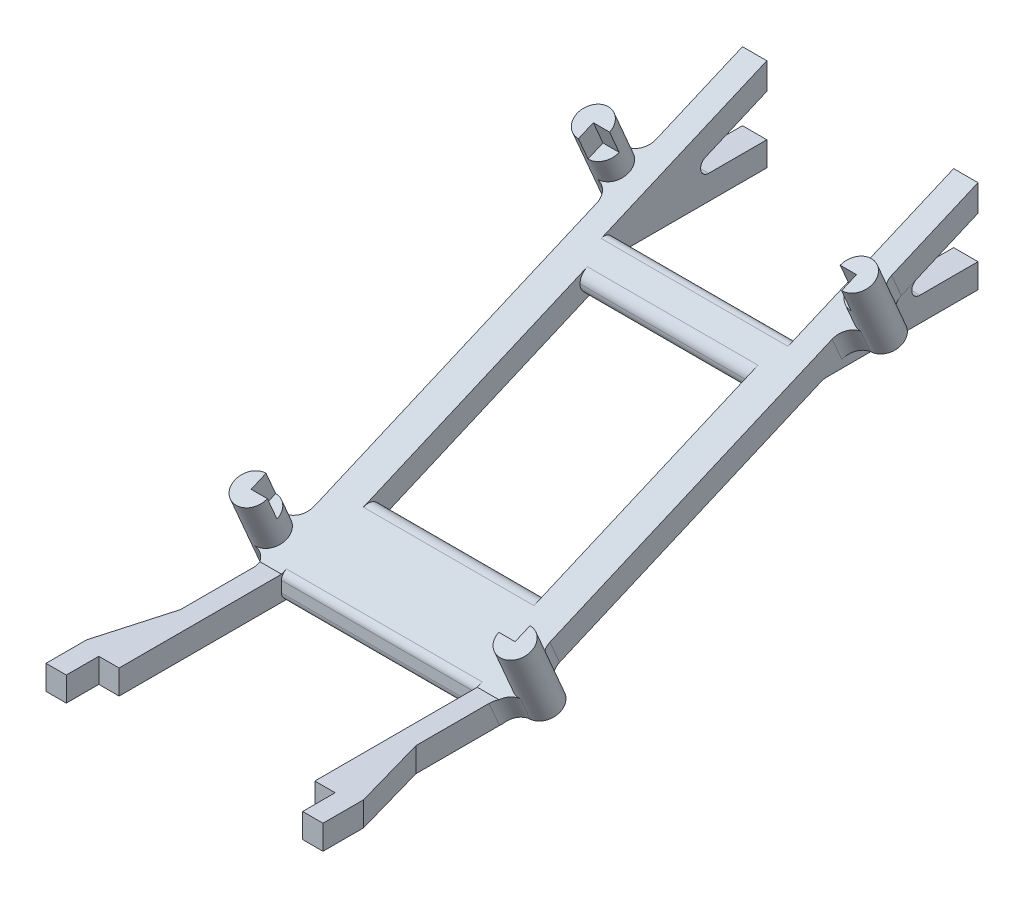
from build123d import *
from build123d.topology import SkipClean

# Parameters (mm, degrees)
BOSS_EXTRUDE1_DEPTH   = 29
SKETCH2_W             = 24.1
SKETCH2_H             = 40
CUT_EXTRUDE1_DEPTH    = 28
SKETCH3_W             = 21
SKETCH3_H             = 24.583031318
CUT_EXTRUDE2_DEPTH    = 28
SKETCH4_W             = 23
SKETCH4_H             = 38
CUT_EXTRUDE3_DEPTH    = 87.03859599
BOSS_EXTRUDE2_DEPTH   = 6
BOSS_EXTRUDE2_2_DEPTH = 6
SKETCH7_R             = 2
BOSS_EXTRUDE3_DEPTH   = 3
SKETCH8_R             = 2
BOSS_EXTRUDE4_DEPTH   = 3
FILLET5_R             = 1
FILLET1_R             = 2
BOSS_EXTRUDE5_DEPTH   = 6
BOSS_EXTRUDE5_2_DEPTH = 6
SKETCH10_R            = 2
BOSS_EXTRUDE6_DEPTH   = 3
SKETCH11_R            = 2
BOSS_EXTRUDE7_DEPTH   = 3
FILLET2_R             = 2
FILLET3_R             = 1
FILLET4_R             = 1.5
FILLET6_R             = 1
FILLET7_R             = 1
BOSS_EXTRUDE8_DEPTH   = 3


# Some blends are built 0.0001 mm under size
with BuildPart() as part:
    # Sketch1 → Boss-Extrude1 (new body)
    with BuildSketch(Plane(origin=(0, 0, 0), x_dir=(0, 0, -1), z_dir=(1, 0, 0))):
        Polygon((0, 0), (20.616968682, 0), (60.2, 17), (79.2, 17), (79.2, 20), (67.185240821, 20), (79.2, 25.16006226), (79.2, 28.425036095), (20, 3), (0, 3), align=None)
    extrude(amount=BOSS_EXTRUDE1_DEPTH)

    # Sketch2 → Cut-Extrude1 (cut)
    with BuildSketch(Plane(origin=(0, 3, 0), x_dir=(1, 0, 0), z_dir=(0, 1, 0))):
        with Locations((14.5, 0)):
            Rectangle(SKETCH2_W, SKETCH2_H)
    extrude(amount=-CUT_EXTRUDE1_DEPTH, mode=Mode.SUBTRACT)

    # Sketch3 → Cut-Extrude2 (cut)
    with BuildSketch(Plane.XZ):
        with Locations((14.5, -42.908484341)):
            Rectangle(SKETCH3_W, SKETCH3_H)
    extrude(amount=-CUT_EXTRUDE2_DEPTH, mode=Mode.SUBTRACT)

    # Sketch4 → Cut-Extrude3 (cut, through all)
    with BuildSketch(Plane.XZ.offset(-17)):
        with Locations((14.5, -79.2)):
            Rectangle(SKETCH4_W, SKETCH4_H)
    extrude(amount=-CUT_EXTRUDE3_DEPTH, mode=Mode.SUBTRACT)



with BuildPart() as body_2:
    # Sketch6 → Boss-Extrude2 (new body)
    with BuildSketch(Plane(origin=(0, -4.719099202, -2.026744384), x_dir=(1, 0, 0), z_dir=(0, 0.9188435044080576, 0.3946221159630054))):
        with BuildLine():
            Line((-1.75, 22.633400601), (-1.75, 24.633400601))
            ThreePointArc((-1.75, 24.633400601), (-3.164213562, 21.219187039), (0.25, 22.633400601))
            Line((0.25, 22.633400601), (-1.75, 22.633400601))
        make_face()
    extrude(amount=BOSS_EXTRUDE2_DEPTH)


with BuildPart() as body_3:
    # Sketch6 → Boss-Extrude2 2 (new body)
    with BuildSketch(Plane(origin=(0, -4.719099202, -2.026744384), x_dir=(1, 0, 0), z_dir=(0, 0.9188435044080576, 0.3946221159630054))):
        with BuildLine():
            ThreePointArc((28.75, 22.633400601), (32.164213562, 21.219187039), (30.75, 24.633400601))
            Line((30.75, 24.633400601), (30.75, 22.633400601))
            Line((30.75, 22.633400601), (28.75, 22.633400601))
        make_face()
    extrude(amount=BOSS_EXTRUDE2_2_DEPTH)


    with SkipClean():  # the faces are left unmerged after this step: merging them gives an invalid solid
        add(body_2.part)  # Boss-Extrude3 merges body 2
        # Sketch7 → Boss-Extrude3 (add)
        with BuildSketch(Plane(origin=(0, -4.719099202, -2.026744384), x_dir=(1, 0, 0), z_dir=(0, -0.9188435044080577, -0.39462211596300556))):
            with Locations(Location((30.75, -22.633400601, 0), (0, 0, 270))):
                Circle(SKETCH7_R)
            with Locations(Location((-1.75, -22.633400601, 0), (0, 0, 270))):
                Circle(SKETCH7_R)
        extrude(amount=-BOSS_EXTRUDE3_DEPTH)


with BuildPart() as part_1:
    add(part.part)

    add(body_3.part)  # Boss-Extrude4 merges body 3
    # Sketch8 → Boss-Extrude4 (add)
    with BuildSketch(Plane(origin=(0, -4.719099202, -2.026744384), x_dir=(1, 0, 0), z_dir=(0, -0.9188435044080577, -0.39462211596300556))):
        with BuildLine():
            Line((30.75, -20.633400601), (-1.75, -20.633400601))
            ThreePointArc((-1.75, -20.633400601), (-0.335786438, -21.219187039), (0.25, -22.633400601))
            ThreePointArc((0.25, -22.633400601), (-0.335786438, -24.047614164), (-1.75, -24.633400601))
            Line((-1.75, -24.633400601), (30.75, -24.633400601))
            ThreePointArc((30.75, -24.633400601), (28.75, -22.633400601), (30.75, -20.633400601))
        make_face()
        with Locations(Location((30.75, -22.633400601, 0), (0, 0, 270))):
            Circle(SKETCH8_R)
        with Locations(Location((-1.75, -22.633400601, 0), (0, 0, 270))):
            Circle(SKETCH8_R)
    extrude(amount=BOSS_EXTRUDE4_DEPTH)

    # Fillet5
    fillet5_edges = [part_1.edges().sort_by_distance(p)[0] for p in [
        (14.5, 17, -60.2),
    ]]
    fillet(fillet5_edges, radius=FILLET5_R)

    # Fillet1
    # the kernel refuses this fillet: 2 mm, written as the material it adds along each edge
    with BuildSketch(Plane(origin=(0, 17, -60.2), x_dir=(0, -0.39462211596300395, 0.9188435044080584), z_dir=(1, 0, 0)), Plane(origin=(26, 17, -60.2), x_dir=(0, -0.39462211596300395, 0.9188435044080584), z_dir=(1, 0, 0))) as fillet1_piece_1:
        with BuildLine():
            CenterArc((FILLET1_R * 0.205656227335, FILLET1_R), FILLET1_R, 246.757591511, 23.242408489)
            Line((-FILLET1_R * 0.188965888628, FILLET1_R * 0.0811564955919), (0, 0))
            Line((0, 0), (FILLET1_R * 0.205656227335, 0))
        make_face()
    extrude(amount=3)
    with BuildSketch(Plane(origin=(29, 0.666766489, -22.169476849), x_dir=(0.9999978256192742, 0.000822932051561906, -0.0019161261864445022), z_dir=(0, 0.9188435044080576, 0.3946221159630056))) as fillet1_piece_2_section:
        with BuildLine():
            CenterArc((1.995841225, -1.996346258), FILLET1_R, 93.463838868, 86.416678302)
            Line((-0.004154427, -1.992175524), (-0.204153992, -1.99175845))
            Line((-0.204153992, -1.99175845), (-0.199999565, 0.000417073))
            Line((-0.199999565, 0.000417073), (0.000417073, 0.199999565))
            ThreePointArc((0.000417073, 0.199999565), (1.750413268, 0.196350172), (1.862920362, 0.199634626))
            Line((1.862920362, 0.199634626), (1.875004077, 0))
        make_face()
    fillet1_piece_2 = extrude(amount=7.980449639, mode=Mode.PRIVATE)
    fillet1_piece_2 = split(fillet1_piece_2, bisect_by=Plane(origin=(29, 0, -22.169476849), z_dir=(0, 1, 0)), keep=Keep.TOP, mode=Mode.PRIVATE)
    fillet1_piece_2 = split(fillet1_piece_2, bisect_by=Plane(origin=(29, 3, -22.169476849), z_dir=(0, -1, 0)), keep=Keep.TOP, mode=Mode.PRIVATE)
    add(fillet1_piece_2)
    with BuildSketch(Plane(origin=(29, -3.909487311, -24.134872424), x_dir=(0.9999978256192742, 0.000822932051561906, -0.0019161261864445022), z_dir=(0, 0.9188435044080576, 0.3946221159630056))) as fillet1_piece_3_section:
        with BuildLine():
            CenterArc((1.995841225, -1.996346258), FILLET1_R, 93.463838868, 86.416678302)
            Line((-0.004154427, -1.992175524), (-0.204153992, -1.99175845))
            Line((-0.204153992, -1.99175845), (-0.199999565, 0.000417073))
            Line((-0.199999565, 0.000417073), (0.000417073, 0.199999565))
            ThreePointArc((0.000417073, 0.199999565), (1.750413268, 0.196350172), (1.862920362, 0.199634626))
            Line((1.862920362, 0.199634626), (1.875004077, 0))
        make_face()
    fillet1_piece_3 = extrude(amount=7.980449639, mode=Mode.PRIVATE)
    fillet1_piece_3 = split(fillet1_piece_3, bisect_by=Plane(origin=(29, 3, -24.134872424), z_dir=(0, 1, 0)), keep=Keep.TOP, mode=Mode.PRIVATE)
    add(fillet1_piece_3)
    with BuildSketch(Plane(origin=(29, 5.001785466, -24.660984518), x_dir=(0, 0.3946221159630056, -0.9188435044080575), z_dir=(0, -0.9188435044080576, -0.3946221159630056))) as fillet1_piece_4:
        with BuildLine():
            CenterArc((1.992179856, 2), FILLET1_R, 183.583321698, 86.416678302)
            Line((-0.003910072, 1.875), (-0.203519065, 1.8625))
            ThreePointArc((-0.203519065, 1.8625), (-0.2, 1.75), (-0.2, 0))
            Line((-0.2, 0), (0, -0.2))
            Line((0, -0.2), (1.992179856, -0.2))
            Line((1.992179856, -0.2), (1.992179856, 0))
        make_face()
    extrude(amount=3)
    with BuildSketch(Plane(origin=(0, 5.001785466, -24.660984518), x_dir=(0, 0.3946221159630056, -0.9188435044080576), z_dir=(0, -0.9188435044080576, -0.3946221159630056))) as fillet1_piece_5:
        with BuildLine():
            CenterArc((1.992179856, -2), FILLET1_R, 90, 86.416678302)
            Line((-0.003910072, -1.875), (-0.203519065, -1.8625))
            ThreePointArc((-0.203519065, -1.8625), (-0.2, -1.75), (-0.2, 0))
            Line((-0.2, 0), (0, 0.2))
            Line((0, 0.2), (1.992179856, 0.2))
            Line((1.992179856, 0.2), (1.992179856, 0))
        make_face()
    extrude(amount=3)
    with BuildSketch(Plane(origin=(0, 0.666766489, -22.169476849), x_dir=(-0.9999978256192742, 0.0008229320515609999, -0.0019161261864423925), z_dir=(0, 0.9188435044080576, 0.3946221159630056))) as fillet1_piece_6_section:
        with BuildLine():
            CenterArc((1.995841225, 1.996346258), FILLET1_R, 180.119482831, 86.416678302)
            Line((-0.004154427, 1.992175524), (-0.204153992, 1.99175845))
            Line((-0.204153992, 1.99175845), (-0.199999565, -0.000417073))
            Line((-0.199999565, -0.000417073), (0.000417073, -0.199999565))
            ThreePointArc((0.000417073, -0.199999565), (1.750413268, -0.196350172), (1.862920362, -0.199634626))
            Line((1.862920362, -0.199634626), (1.875004077, 0))
        make_face()
    fillet1_piece_6 = extrude(amount=7.980449639, mode=Mode.PRIVATE)
    fillet1_piece_6 = split(fillet1_piece_6, bisect_by=Plane(origin=(0, 0, -22.169476849), z_dir=(0, 1, 0)), keep=Keep.TOP, mode=Mode.PRIVATE)
    fillet1_piece_6 = split(fillet1_piece_6, bisect_by=Plane(origin=(0, 3, -22.169476849), z_dir=(0, -1, 0)), keep=Keep.TOP, mode=Mode.PRIVATE)
    add(fillet1_piece_6)
    with BuildSketch(Plane(origin=(0, -3.909487311, -24.134872424), x_dir=(-0.9999978256192742, 0.0008229320515609999, -0.0019161261864423925), z_dir=(0, 0.9188435044080576, 0.3946221159630056))) as fillet1_piece_7_section:
        with BuildLine():
            CenterArc((1.995841225, 1.996346258), FILLET1_R, 180.119482831, 86.416678302)
            Line((-0.004154427, 1.992175524), (-0.204153992, 1.99175845))
            Line((-0.204153992, 1.99175845), (-0.199999565, -0.000417073))
            Line((-0.199999565, -0.000417073), (0.000417073, -0.199999565))
            ThreePointArc((0.000417073, -0.199999565), (1.750413268, -0.196350172), (1.862920362, -0.199634626))
            Line((1.862920362, -0.199634626), (1.875004077, 0))
        make_face()
    fillet1_piece_7 = extrude(amount=7.980449639, mode=Mode.PRIVATE)
    fillet1_piece_7 = split(fillet1_piece_7, bisect_by=Plane(origin=(0, 3, -24.134872424), z_dir=(0, 1, 0)), keep=Keep.TOP, mode=Mode.PRIVATE)
    add(fillet1_piece_7)



with BuildPart() as body_2_2:
    # Sketch9 → Boss-Extrude5 (new body)
    with BuildSketch(Plane(origin=(0, -4.719099202, -2.026744384), x_dir=(1, 0, 0), z_dir=(0, 0.9188435044080577, 0.39462211596300545))):
        with BuildLine():
            ThreePointArc((0.3, 68.433400601), (-3.114213562, 69.847614164), (-1.7, 66.433400601))
            Line((-1.7, 66.433400601), (-1.7, 68.433400601))
            Line((-1.7, 68.433400601), (0.3, 68.433400601))
        make_face()
    extrude(amount=BOSS_EXTRUDE5_DEPTH)



with BuildPart() as body_3_2:
    # Sketch9 → Boss-Extrude5 2 (new body)
    with BuildSketch(Plane(origin=(0, -4.719099202, -2.026744384), x_dir=(1, 0, 0), z_dir=(0, 0.9188435044080577, 0.39462211596300545))):
        with BuildLine():
            ThreePointArc((30.7, 66.433400601), (32.114213562, 69.847614164), (28.7, 68.433400601))
            Line((28.7, 68.433400601), (30.7, 68.433400601))
            Line((30.7, 68.433400601), (30.7, 66.433400601))
        make_face()
    extrude(amount=BOSS_EXTRUDE5_2_DEPTH)


with BuildPart() as body_2_2_1:
    with SkipClean():  # the faces are left unmerged after this step: merging them gives an invalid solid
        add(body_2_2.part)

        add(body_3_2.part)  # Boss-Extrude6 merges body 3 2
        # Sketch10 → Boss-Extrude6 (add)
        with BuildSketch(Plane(origin=(0, -4.719099202, -2.026744384), x_dir=(1, 0, 0), z_dir=(0, -0.9188435044080576, -0.3946221159630054))):
            with Locations(Location((30.7, -68.433400601, 0), (0, 0, 90))):
                Circle(SKETCH10_R)
            with Locations(Location((-1.7, -68.433400601, 0), (0, 0, 90))):
                Circle(SKETCH10_R)
        extrude(amount=-BOSS_EXTRUDE6_DEPTH)


with BuildPart() as part_2:
    add(part_1.part)

    add(body_2_2_1.part)  # Boss-Extrude7 merges body 2 2
    # Sketch11 → Boss-Extrude7 (add)
    with BuildSketch(Plane(origin=(0, -4.719099202, -2.026744384), x_dir=(1, 0, 0), z_dir=(0, -0.9188435044080576, -0.3946221159630054))):
        with BuildLine():
            ThreePointArc((0.3, -68.433400601), (-0.285786438, -69.847614164), (-1.7, -70.433400601))
            Line((-1.7, -70.433400601), (3, -70.433400601))
            Line((3, -70.433400601), (3, -66.433400601))
            Line((3, -66.433400601), (-1.7, -66.433400601))
            ThreePointArc((-1.7, -66.433400601), (-0.285786438, -67.019187039), (0.3, -68.433400601))
        make_face()
        with Locations(Location((-1.7, -68.433400601, 0), (0, 0, 90))):
            Circle(SKETCH11_R)
        with BuildLine():
            Line((26, -66.433400601), (26, -70.433400601))
            Line((26, -70.433400601), (30.7, -70.433400601))
            ThreePointArc((30.7, -70.433400601), (28.7, -68.433400601), (30.7, -66.433400601))
            Line((30.7, -66.433400601), (26, -66.433400601))
        make_face()
        with Locations(Location((30.7, -68.433400601, 0), (0, 0, 90))):
            Circle(SKETCH11_R)
    extrude(amount=BOSS_EXTRUDE7_DEPTH)

    # Fillet2
    # the kernel refuses this fillet: 2 mm, written as the material it adds along each edge
    with BuildSketch(Plane(origin=(0, 21.496989914, -63.068643003), x_dir=(0, -0.3946221159630054, 0.9188435044080576), z_dir=(0, -0.9188435044080577, -0.39462211596300545)), Plane(origin=(29, 18.740459401, -64.252509351), x_dir=(0, -0.39462211596300545, 0.9188435044080577), z_dir=(0, 0.9188435044080577, 0.39462211596300545))) as fillet2_piece_1:
        with BuildLine():
            CenterArc((1.977371993, 2), FILLET2_R, 188.626926559, 81.373073441)
            Line((0, 1.7), (0, 0))
            Line((0, 0), (1.977371993, 0))
        make_face()
    extrude(amount=3)
    with BuildSketch(Plane(origin=(0, 20.318947864, -67.927883368), x_dir=(-0.9999953645423342, -0.0012015510438305793, 0.0027977077998891206), z_dir=(0, 0.9188435044080577, 0.39462211596300545)), Plane(origin=(29, 23.075478378, -66.74401702), x_dir=(0.9999953645423341, -0.001201551043837046, 0.0027977077999041767), z_dir=(0, -0.9188435044080577, -0.39462211596300545))) as fillet2_piece_2:
        with BuildLine():
            CenterArc((1.993935403, -1.994814545), FILLET2_R, 94.126767029, 85.698777695)
            Line((-0.006055326, -1.988724916), (-0.206054399, -1.988115953))
            Line((-0.206054399, -1.988115953), (-0.199999073, 0.000608963))
            Line((-0.199999073, 0.000608963), (0.000608963, 0.199999073))
            ThreePointArc((0.000608963, 0.199999073), (1.700601083, 0.194822889), (1.835615893, 0.199481454))
            Line((1.835615893, 0.199481454), (1.850008576, 0))
        make_face()
    extrude(amount=3)

    # Fillet3
    # the kernel refuses this fillet: 1 mm, written as the material it adds along each edge
    with BuildSketch(Plane(origin=(26, 20, -67.185240821), x_dir=(0, 0, -1), z_dir=(1, 0, 0))) as fillet3_piece_1:
        with BuildLine():
            CenterArc((FILLET3_R * 4.86248344122, FILLET3_R), FILLET3_R, 113.242408489, 156.757591511)
            Line((FILLET3_R * 4.46786132525, FILLET3_R * 1.91884350441), (FILLET3_R * 4.45996888293, FILLET3_R * 1.9372203745))
            Line((FILLET3_R * 4.45996888293, FILLET3_R * 1.9372203745), (-FILLET3_R * 0.00789244231926, FILLET3_R * 0.0183768700882))
            Line((-FILLET3_R * 0.00789244231926, FILLET3_R * 0.0183768700882), (0, -FILLET3_R * 0.02))
            Line((0, -FILLET3_R * 0.02), (FILLET3_R * 4.86248344122, -FILLET3_R * 0.02))
            Line((FILLET3_R * 4.86248344122, -FILLET3_R * 0.02), (FILLET3_R * 4.86248344122, 0))
        make_face()
    extrude(amount=3)
    with BuildSketch(Plane(origin=(0, 20, -67.185240821), x_dir=(0, 0.39462211596300517, -0.9188435044080577), z_dir=(1, 0, 0))) as fillet3_piece_2:
        with BuildLine():
            CenterArc((FILLET3_R * 4.86248344122, -FILLET3_R), FILLET3_R, 90, 156.757591511)
            Line((FILLET3_R * 4.46786132525, -FILLET3_R * 1.91884350441), (FILLET3_R * 4.45996888293, -FILLET3_R * 1.9372203745))
            Line((FILLET3_R * 4.45996888293, -FILLET3_R * 1.9372203745), (-FILLET3_R * 0.00789244231926, -FILLET3_R * 0.0183768700882))
            Line((-FILLET3_R * 0.00789244231926, -FILLET3_R * 0.0183768700882), (0, FILLET3_R * 0.02))
            Line((0, FILLET3_R * 0.02), (FILLET3_R * 4.86248344122, FILLET3_R * 0.02))
            Line((FILLET3_R * 4.86248344122, FILLET3_R * 0.02), (FILLET3_R * 4.86248344122, 0))
        make_face()
    extrude(amount=3)

    # Fillet4
    fillet4_edges = [part_2.edges().sort_by_distance(p)[0] for p in [
        (14.5, 7.559743445, -30.616968682),
        (14.5, 18.117589029, -55.2),
        (14.5, 14.852615195, -55.2),
        (14.5, 4.294769611, -30.616968682),
    ]]
    fillet(fillet4_edges, radius=FILLET4_R - 0.0001)  # a hair under: the kernel refuses the full size

    # Fillet6
    fillet6_edges = [part_2.edges().sort_by_distance(p)[0] for p in [
        (14.5, 20.264973835, -60.2),
    ]]
    fillet(fillet6_edges, radius=FILLET6_R)

    # Fillet7
    # the kernel refuses this fillet: 1 mm, written as the material it takes off along each edge
    with BuildSketch(Plane(origin=(26.55, 3, -20), x_dir=(0, 0.39462211596391505, -0.918843504407667), z_dir=(-1, 0, 0))) as fillet7_piece_1:
        with BuildLine():
            CenterArc((FILLET7_R * 0.658847650478, FILLET7_R), FILLET7_R, 203.242408489, 66.757591511)
            Line((-FILLET7_R * 0.25999585393, FILLET7_R * 0.605377884037), (0, 0))
            Line((0, 0), (FILLET7_R * 0.658847650479, 0))
        make_face()
    extrude(amount=24.1, mode=Mode.SUBTRACT)
    with BuildSketch(Plane(origin=(26.55, 0, -20), x_dir=(0, 0, -1), z_dir=(-1, 0, 0))) as fillet7_piece_2:
        with BuildLine():
            CenterArc((FILLET7_R, -FILLET7_R), FILLET7_R, 90, 90)
            Line((0, -FILLET7_R), (0, 0))
            Line((0, 0), (FILLET7_R, 0))
        make_face()
    extrude(amount=24.1, mode=Mode.SUBTRACT)

    # Sketch12 → Boss-Extrude8 (add)
    with BuildSketch(Plane(origin=(0, 3, 0), x_dir=(1, 0, 0), z_dir=(0, 1, 0))):
        Polygon((0, 0), (-0.05, 0), (-0.05, -4), (-2.55, -4), (-2.55, 1), (0, 10), align=None)
        Polygon((29, 10), (29, 0), (29.05, 0), (29.05, -4), (31.55, -4), (31.55, 1), align=None)
    extrude(amount=-BOSS_EXTRUDE8_DEPTH)


solid = part_2.part
